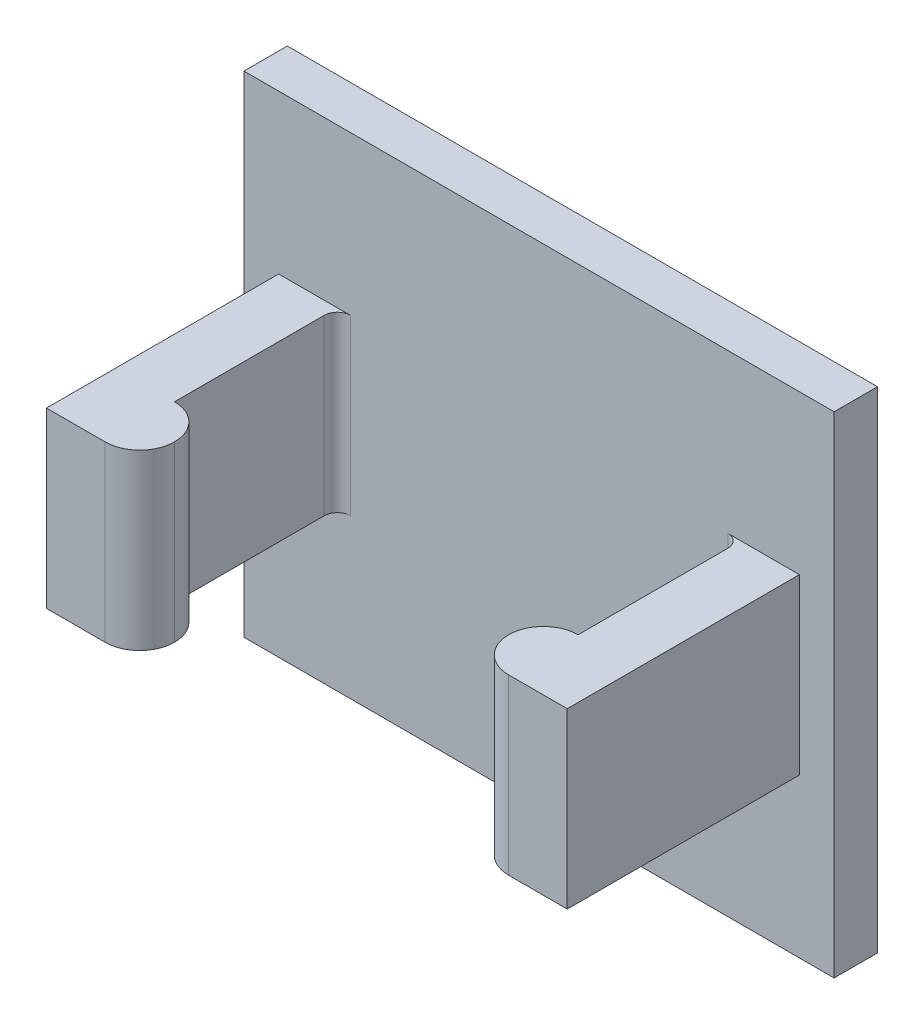
from build123d import *

# Parameters (mm, degrees)
SKETCH_1_W      = 12
SKETCH_1_H      = 11.3
EXTRUDE_1_DEPTH = 1
SKETCH_2_W      = 1.35
SKETCH_2_H      = 4
EXTRUDE_2_DEPTH = 5.35
SKETCH_3_W      = 1.6
SKETCH_3_H      = 4
EXTRUDE_3_DEPTH = 0.8
SKETCH_4_W      = 1.6
SKETCH_4_H      = 4
EXTRUDE_4_DEPTH = 0.8
FILLET_1_R      = 0.8
FILLET_2_R      = 0.3
SKETCH_5_W      = 1
SKETCH_5_H      = 11.3
EXTRUDE_5_DEPTH = 0.8
SKETCH_6_W      = 1
SKETCH_6_H      = 11.3
EXTRUDE_6_DEPTH = 0.8


with BuildPart() as part:
    # 스케치1 → 보스-돌출1 (new body)
    with BuildSketch(Plane.XY):
        Rectangle(SKETCH_1_W, SKETCH_1_H)
    extrude(amount=EXTRUDE_1_DEPTH)

    # 스케치2 → 보스-돌출2 (add)
    with BuildSketch(Plane.XY.offset(1)):
        with Locations((-5.325, 0)):
            Rectangle(SKETCH_2_W, SKETCH_2_H)
        with Locations((5.325, 0)):
            Rectangle(SKETCH_2_W, SKETCH_2_H)
    extrude(amount=EXTRUDE_2_DEPTH)

    # 스케치3 → 보스-돌출3 (add)
    with BuildSketch(Plane(origin=(-4.65, 0, 0), x_dir=(0, 0, -1), z_dir=(1, 0, 0))):
        with Locations((-5.55, 0)):
            Rectangle(SKETCH_3_W, SKETCH_3_H)
    extrude(amount=EXTRUDE_3_DEPTH)

    # 스케치4 → 보스-돌출4 (add)
    with BuildSketch(Plane.ZY.offset(-4.65)):
        with Locations((5.55, 0)):
            Rectangle(SKETCH_4_W, SKETCH_4_H)
    extrude(amount=EXTRUDE_4_DEPTH)

    # 필렛1
    fillet_1_edges = [part.edges().sort_by_distance(p)[0] for p in [
        (3.85, 0, 6.35),
        (3.85, 0, 4.75),
        (-3.85, 0, 6.35),
        (-3.85, 0, 4.75),
    ]]
    fillet(fillet_1_edges, radius=FILLET_1_R - 0.0001)  # a hair under: the kernel refuses the full size

    # 필렛2
    fillet_2_edges = [part.edges().sort_by_distance(p)[0] for p in [
        (-4.65, 0, 1),
        (4.65, 0, 1),
    ]]
    fillet(fillet_2_edges, radius=FILLET_2_R)

    # 스케치5 → 보스-돌출5 (add)
    with BuildSketch(Plane.ZY.offset(6)):
        with Locations((0.5, 0)):
            Rectangle(SKETCH_5_W, SKETCH_5_H)
    extrude(amount=EXTRUDE_5_DEPTH)

    # 스케치6 → 보스-돌출6 (add)
    with BuildSketch(Plane(origin=(6, 0, 0), x_dir=(0, 0, -1), z_dir=(1, 0, 0))):
        with Locations((-0.5, 0)):
            Rectangle(SKETCH_6_W, SKETCH_6_H)
    extrude(amount=EXTRUDE_6_DEPTH)


solid = part.part
